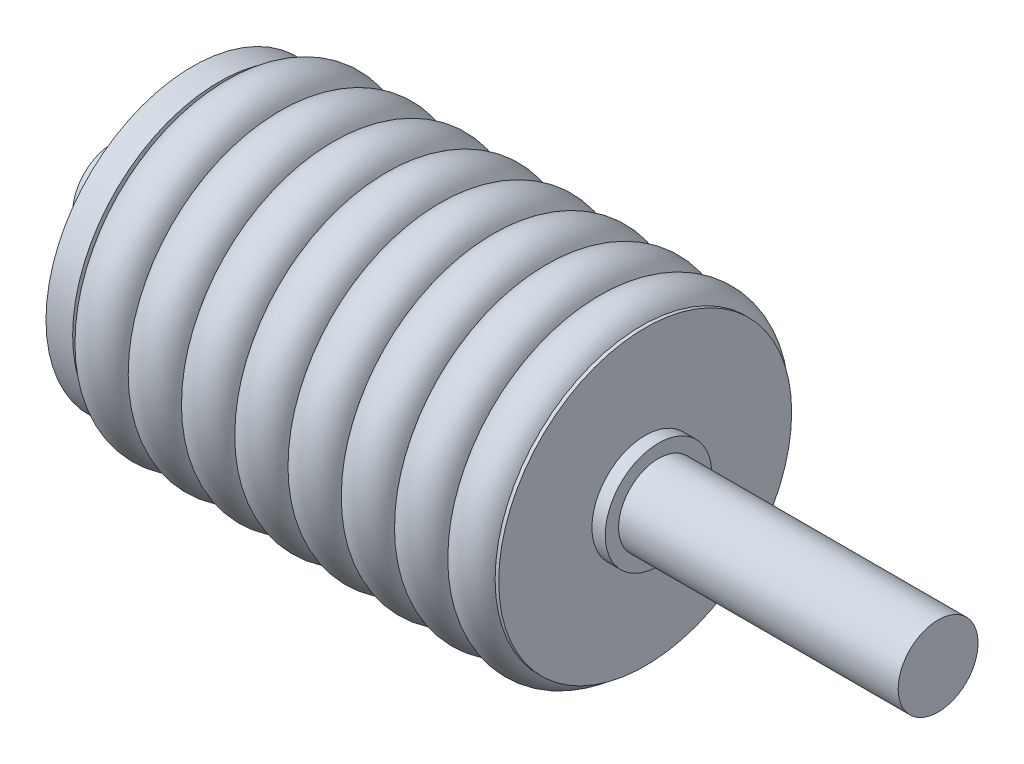
from build123d import *

# Parameters (mm, degrees)
SKETCH_5_R             = 2
PATTERN_LINEAR_2_COUNT = 8
PATTERN_LINEAR_2_PITCH = 4


with BuildPart() as part:
    # 草图2 → 旋转1 (revolve)
    with BuildSketch(Plane.XY):
        Polygon((32, 11), (34, 11), (34, 4), (35, 4), (35, 3), (56, 3), (56, 0), (-6, 0), (-6, 3), (-1, 3), (-1, 4), (0, 4), (0, 11), (2, 11), (2, 8), (32, 8), align=None)
    revolve(axis=Axis((-6, 0, 0), (1, 0, 0)))


with BuildPart() as body_2:
    # 草图5 → 旋转2 (revolve)
    with BuildSketch(Plane.XY):
        with Locations((4, 10)):
            Circle(SKETCH_5_R)
    revolve(axis=Axis((0, 0, 0), (1, 0, 0)))


with BuildPart() as pattern_linear_2_1:
    # 阵列(线性)2: pattern copy
    add(body_2.part.moved(Location(Vector(1, 0, 0) * (1 * PATTERN_LINEAR_2_PITCH))))


with BuildPart() as pattern_linear_2_2:
    # 阵列(线性)2: pattern copy
    add(body_2.part.moved(Location(Vector(1, 0, 0) * (2 * PATTERN_LINEAR_2_PITCH))))


with BuildPart() as pattern_linear_2_3:
    # 阵列(线性)2: pattern copy
    add(body_2.part.moved(Location(Vector(1, 0, 0) * (3 * PATTERN_LINEAR_2_PITCH))))


with BuildPart() as pattern_linear_2_4:
    # 阵列(线性)2: pattern copy
    add(body_2.part.moved(Location(Vector(1, 0, 0) * (4 * PATTERN_LINEAR_2_PITCH))))


with BuildPart() as pattern_linear_2_5:
    # 阵列(线性)2: pattern copy
    add(body_2.part.moved(Location(Vector(1, 0, 0) * (5 * PATTERN_LINEAR_2_PITCH))))


with BuildPart() as pattern_linear_2_6:
    # 阵列(线性)2: pattern copy
    add(body_2.part.moved(Location(Vector(1, 0, 0) * (6 * PATTERN_LINEAR_2_PITCH))))


with BuildPart() as pattern_linear_2_7:
    # 阵列(线性)2: pattern copy
    add(body_2.part.moved(Location(Vector(1, 0, 0) * (7 * PATTERN_LINEAR_2_PITCH))))


solid = Compound([part.part, body_2.part, pattern_linear_2_1.part, pattern_linear_2_2.part, pattern_linear_2_3.part, pattern_linear_2_4.part, pattern_linear_2_5.part, pattern_linear_2_6.part, pattern_linear_2_7.part])
